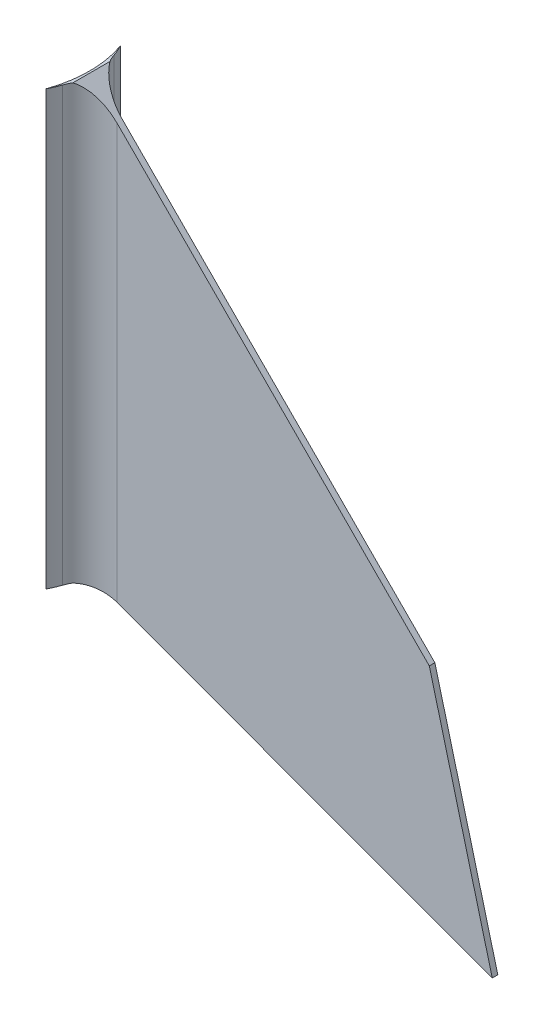
from build123d import *

# Parameters (mm, degrees)
BOSS_EXTRUDE1_DEPTH      = 1.5
BOSS_EXTRUDE1_DEPTH_BACK = 1.5
BOSS_EXTRUDE2_DEPTH      = 234
FILLET1_R                = 37
FILLET2_R                = 37
FILLET3_R                = 18
FILLET4_R                = 18


with BuildPart() as part:
    # Sketch1 → Boss-Extrude1 (new, two sides: drawn at the far end of the back side and taken through both)
    with BuildSketch(Plane.XY.offset(-BOSS_EXTRUDE1_DEPTH_BACK)):
        Polygon((0, 0), (0, 234), (184, 49), (218, -80), align=None)
    extrude(amount=BOSS_EXTRUDE1_DEPTH + BOSS_EXTRUDE1_DEPTH_BACK)

    # Sketch3 → Boss-Extrude2 (add)
    with BuildSketch(Plane(origin=(0, 0, 0), x_dir=(1, 0, 0), z_dir=(0, 1, 0))):
        with BuildLine():
            Line((0, 0), (0, 20))
            Line((0, 20), (-4.431457505, 20))
            ThreePointArc((-4.431457505, 20), (-1, 0), (-4.431457505, -20))
            Line((-4.431457505, -20), (0, -20))
            Line((0, -20), (0, 0))
        make_face()
    extrude(amount=BOSS_EXTRUDE2_DEPTH)

    # Fillet1
    # the kernel refuses this fillet: 37 mm, written as the material it takes off along each edge
    with BuildSketch(Plane(origin=(0, -43.895475262, -20), x_dir=(-1, 0, 0), z_dir=(0, 1, 0))) as fillet1_piece_1:
        with BuildLine():
            CenterArc((37, 17.558190105), FILLET1_R, 180, 28.329773325)
            Line((0, 17.558190105), (-0.74, 17.558190105))
            Line((-0.74, 17.558190105), (-0.74, 0))
            Line((-0.74, 0), (0, -0.74))
            ThreePointArc((0, -0.74), (2.215728753, -0.74), (3.780086655, -0.351163802))
            Line((3.780086655, -0.351163802), (4.431457505, 0))
        make_face()
    extrude(amount=321.790950524, mode=Mode.SUBTRACT)

    # Fillet2
    # the kernel refuses this fillet: 37 mm, written as the material it takes off along each edge
    with BuildSketch(Plane(origin=(0, -43.895475262, 20), x_dir=(-1, 0, 0), z_dir=(0, 1, 0))) as fillet2_piece_1:
        with BuildLine():
            CenterArc((37, -17.558190105), FILLET2_R, 151.670226675, 28.329773325)
            Line((0, -17.558190105), (-0.74, -17.558190105))
            Line((-0.74, -17.558190105), (-0.74, 0))
            Line((-0.74, 0), (0, 0.74))
            ThreePointArc((0, 0.74), (2.215728753, 0.74), (3.780086655, 0.351163802))
            Line((3.780086655, 0.351163802), (4.431457505, 0))
        make_face()
    extrude(amount=321.790950524, mode=Mode.SUBTRACT)

    # Fillet3
    # the kernel refuses this fillet: 18 mm, written as the material it adds along each edge
    with BuildSketch(Plane(origin=(0, -38.219598529, 1.5), x_dir=(-0.1453745067000553, 0, 0.9893766991402797), z_dir=(0, 1, 0))) as fillet3_piece_1_section:
        with BuildLine():
            CenterArc((15.586318472, 17.742173215), FILLET3_R, 188.358966638, 71.931795215)
            Line((-2.222462113, 15.125432094), (-4.003340171, 14.863757982))
            Line((-4.003340171, 14.863757982), (-1.780878058, -0.261674112))
            Line((-1.780878058, -0.261674112), (0.261674112, -1.780878058))
            ThreePointArc((0.261674112, -1.780878058), (1.193478877, -1.64396291), (12.247081967, -1.774217321))
            Line((12.247081967, -1.774217321), (12.550648922, 0))
        make_face()
    fillet3_piece_1 = extrude(amount=272.219598529, mode=Mode.PRIVATE)
    fillet3_piece_1 = fillet3_piece_1 - Plane(origin=(-61, -0.93503603, 0), x_dir=(0.9428090415820632, 0, -0.3333333333333337), z_dir=(0, -1, 0)) * Cylinder(60, 605, mode=Mode.PRIVATE)
    fillet3_piece_1 = split(fillet3_piece_1, bisect_by=Plane(origin=(6.052795765, -2.221209455, 3.73592086), z_dir=(0.34450770303612605, 0.9387834907734437, 0)), keep=Keep.TOP, mode=Mode.PRIVATE)
    fillet3_piece_1 = split(fillet3_piece_1, bisect_by=Plane(origin=(120.710503396, 112.633461259, 3.73592086), z_dir=(-0.7090204561204898, -0.7051879131144355, 0)), keep=Keep.TOP, mode=Mode.PRIVATE)
    add(fillet3_piece_1)
    with BuildSketch(Plane(origin=(0, 0, 1.5), x_dir=(-0.14537450670005528, 0, 0.9893766991402797), z_dir=(0, 1, 0))) as fillet3_piece_2_section:
        with BuildLine():
            CenterArc((15.586318472, 17.742173215), FILLET3_R, 188.358966638, 71.931795215)
            Line((-2.222462113, 15.125432094), (-4.003340171, 14.863757982))
            Line((-4.003340171, 14.863757982), (-1.780878058, -0.261674112))
            Line((-1.780878058, -0.261674112), (0.261674112, -1.780878058))
            ThreePointArc((0.261674112, -1.780878058), (1.193478877, -1.64396291), (12.247081967, -1.774217321))
            Line((12.247081967, -1.774217321), (12.550648922, 0))
        make_face()
    fillet3_piece_2 = extrude(amount=272.219598529, mode=Mode.PRIVATE)
    fillet3_piece_2 = fillet3_piece_2 - Plane(origin=(-61, 0.334778788, 0), x_dir=(0.9428090415820632, 0, -0.3333333333333337), z_dir=(0, -1, 0)) * Cylinder(60, 605, mode=Mode.PRIVATE)
    fillet3_piece_2 = split(fillet3_piece_2, bisect_by=Plane(origin=(-1.045097549, 0.383522036, 11.887652285), z_dir=(-0.34450770303612605, -0.9387834907734437, 0)), keep=Keep.TOP, mode=Mode.PRIVATE)
    add(fillet3_piece_2)

    # Fillet4
    # the kernel refuses this fillet: 18 mm, written as the material it adds along each edge
    with BuildSketch(Plane(origin=(0, -38.219598529, -1.5), x_dir=(-0.14537450670005567, 0, -0.9893766991402797), z_dir=(0, 1, 0))) as fillet4_piece_1_section:
        with BuildLine():
            CenterArc((15.586318472, -17.742173215), FILLET4_R, 99.709238147, 71.931795215)
            Line((-2.222462113, -15.125432094), (-4.003340171, -14.863757982))
            Line((-4.003340171, -14.863757982), (-1.780878058, 0.261674112))
            Line((-1.780878058, 0.261674112), (0.261674112, 1.780878058))
            ThreePointArc((0.261674112, 1.780878058), (1.193478877, 1.64396291), (12.247081967, 1.774217321))
            Line((12.247081967, 1.774217321), (12.550648922, 0))
        make_face()
    fillet4_piece_1 = extrude(amount=272.219598529, mode=Mode.PRIVATE)
    fillet4_piece_1 = fillet4_piece_1 - Plane(origin=(-61, -0.93503603, 0), x_dir=(0.9428090415820632, 0, -0.3333333333333337), z_dir=(0, -1, 0)) * Cylinder(60, 605, mode=Mode.PRIVATE)
    fillet4_piece_1 = split(fillet4_piece_1, bisect_by=Plane(origin=(120.710503396, 112.633461259, -3.73592086), z_dir=(-0.709020456120464, -0.7051879131144615, 0)), keep=Keep.TOP, mode=Mode.PRIVATE)
    fillet4_piece_1 = split(fillet4_piece_1, bisect_by=Plane(origin=(6.052795765, -2.221209455, -3.73592086), z_dir=(0.34450770303615846, 0.9387834907734318, 0)), keep=Keep.TOP, mode=Mode.PRIVATE)
    add(fillet4_piece_1)
    with BuildSketch(Plane(origin=(0, 0, -1.5), x_dir=(-0.1453745067000557, 0, -0.9893766991402797), z_dir=(0, 1, 0))) as fillet4_piece_2_section:
        with BuildLine():
            CenterArc((15.586318472, -17.742173215), FILLET4_R, 99.709238147, 71.931795215)
            Line((-2.222462113, -15.125432094), (-4.003340171, -14.863757982))
            Line((-4.003340171, -14.863757982), (-1.780878058, 0.261674112))
            Line((-1.780878058, 0.261674112), (0.261674112, 1.780878058))
            ThreePointArc((0.261674112, 1.780878058), (1.193478877, 1.64396291), (12.247081967, 1.774217321))
            Line((12.247081967, 1.774217321), (12.550648922, 0))
        make_face()
    fillet4_piece_2 = extrude(amount=272.219598529, mode=Mode.PRIVATE)
    fillet4_piece_2 = fillet4_piece_2 - Plane(origin=(-61, 0.334778788, 0), x_dir=(0.9428090415820632, 0, -0.3333333333333337), z_dir=(0, -1, 0)) * Cylinder(60, 605, mode=Mode.PRIVATE)
    fillet4_piece_2 = split(fillet4_piece_2, bisect_by=Plane(origin=(-1.045097549, 0.383522036, -11.887652285), z_dir=(-0.34450770303615846, -0.9387834907734318, 0)), keep=Keep.TOP, mode=Mode.PRIVATE)
    add(fillet4_piece_2)


solid = part.part
